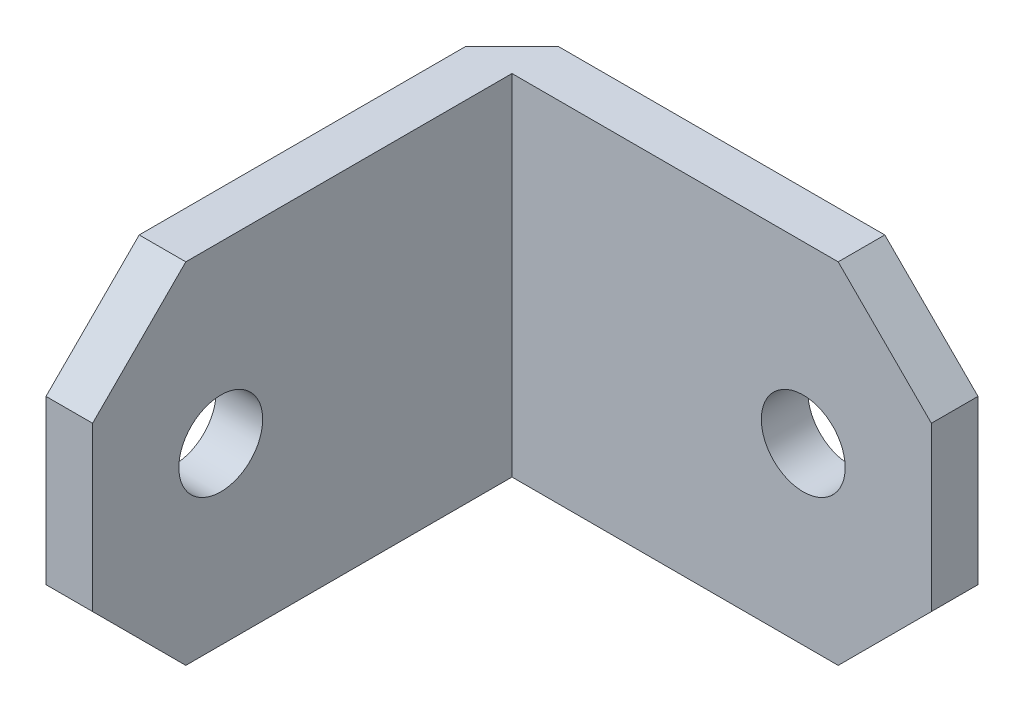
from build123d import *

# Parameters (mm, degrees)
BOSS_EXTRUDE1_DEPTH = 19.05
SKETCH2_R           = 2.286
CUT_EXTRUDE1_DEPTH  = 2.54
SKETCH3_R           = 2.286
CUT_EXTRUDE2_DEPTH  = 2.54
CHAMFER1_SIZE       = 5.08
CHAMFER2_SIZE       = 2.54


with BuildPart() as part:
    # Sketch1 → Boss-Extrude1 (new body)
    with BuildSketch(Plane(origin=(0, 0, 0), x_dir=(1, 0, 0), z_dir=(0, 1, 0))):
        Polygon((0, 14.875697211), (0, 0), (2.54, 0), (2.54, 22.86), (25.4, 22.86), (25.4, 25.4), (0, 25.4), align=None)
    extrude(amount=BOSS_EXTRUDE1_DEPTH)

    # Sketch2 → Cut-Extrude1 (cut)
    with BuildSketch(Plane.XY.offset(-22.86)):
        with Locations((18.415, 9.525)):
            Circle(SKETCH2_R)
    extrude(amount=-CUT_EXTRUDE1_DEPTH, mode=Mode.SUBTRACT)

    # Sketch3 → Cut-Extrude2 (cut)
    with BuildSketch(Plane(origin=(2.54, 0, 0), x_dir=(0, 0, -1), z_dir=(1, 0, 0))):
        with Locations((6.985, 9.525)):
            Circle(SKETCH3_R)
    extrude(amount=-CUT_EXTRUDE2_DEPTH, mode=Mode.SUBTRACT)

    # Chamfer1
    chamfer1_edges = [part.edges().sort_by_distance(p)[0] for p in [
        (1.27, 0, 0),
        (25.4, 0, -24.13),
        (25.4, 19.05, -24.13),
        (1.27, 19.05, 0),
    ]]
    chamfer(chamfer1_edges, length=CHAMFER1_SIZE)

    # Chamfer2
    chamfer2_edges = [part.edges().sort_by_distance(p)[0] for p in [
        (0, 9.525, -25.4),
    ]]
    chamfer(chamfer2_edges, length=CHAMFER2_SIZE)


solid = part.part
